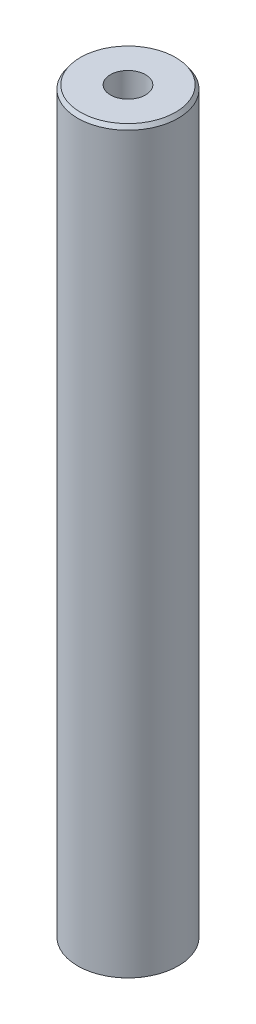
from build123d import *
from OCP.BRepFilletAPI import BRepFilletAPI_MakeChamfer

# Parameters (mm, degrees)
SKETCH1_R           = 40
BOSS_EXTRUDE1_DEPTH = 589.248914064
SKETCH2_R           = 13.998173332
CUT_EXTRUDE1_DEPTH  = 592.958007569
CHAMFER1_SIZE       = 3.039007077
CHAMFER1_SIZE2      = 2.181352696


with BuildPart() as part:
    # Sketch1 → Boss-Extrude1 (new body)
    with BuildSketch(Plane(origin=(0, 0, 0), x_dir=(1, 0, 0), z_dir=(0, 1, 0))):
        Circle(SKETCH1_R)
    extrude(amount=BOSS_EXTRUDE1_DEPTH)

    # Sketch2 → Cut-Extrude1 (cut, through all)
    with BuildSketch(Plane(origin=(0, 0, 0), x_dir=(1, 0, 0), z_dir=(0, 1, 0))):
        Circle(SKETCH2_R)
    extrude(amount=CUT_EXTRUDE1_DEPTH, mode=Mode.SUBTRACT)

    # Chamfer1: one chamfer whose edges measure the first distance from different faces: ONE call of the kernel's chamfer builder (chamfer() names one face for all edges)
    chamfer1_edges_1 = [part.edges().sort_by_distance(p)[0] for p in [
        (-40, 589.248914064, 0),
    ]]
    chamfer1_side_1 = [part.faces().sort_by_distance(p)[0] for p in [
        (-40, 294.624457032, 0),
    ]]
    chamfer1_edges_2 = [part.edges().sort_by_distance(p)[0] for p in [
        (-40, 0, 0),
    ]]
    chamfer1_side_2 = [part.faces().sort_by_distance(p)[0] for p in [
        (-38.86862915, 0, 0),
    ]]
    chamfer1 = BRepFilletAPI_MakeChamfer(part.part.solid().wrapped)
    for e in chamfer1_edges_1:
        chamfer1.Add(CHAMFER1_SIZE, CHAMFER1_SIZE2, e.wrapped, chamfer1_side_1[0].wrapped)  # the first distance lies on this face
    for e in chamfer1_edges_2:
        chamfer1.Add(CHAMFER1_SIZE, CHAMFER1_SIZE2, e.wrapped, chamfer1_side_2[0].wrapped)  # the first distance lies on this face
    add(Compound.cast(chamfer1.Shape()), mode=Mode.REPLACE)


solid = part.part
